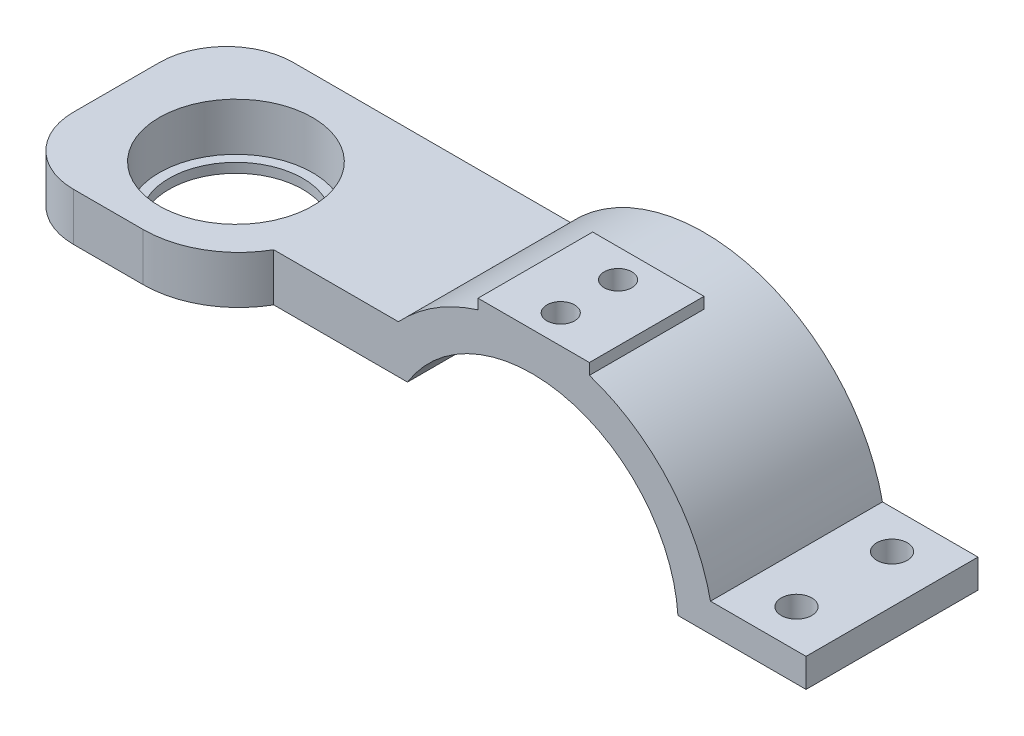
from build123d import *

# Parameters (mm, degrees)
BOSS_EXTRUDE1_DEPTH = 18
SKETCH3_R           = 1.6
CUT_EXTRUDE1_DEPTH  = 56.244999774
SKETCH5_W           = 22.958144304
SKETCH5_H           = 5
BOSS_EXTRUDE2_DEPTH = 5
SKETCH6_R           = 8.025
CUT_EXTRUDE2_DEPTH  = 57.329388422
SKETCH7_R           = 9
SKETCH7_R_2         = 7
BOSS_EXTRUDE3_DEPTH = 1
FILLET1_R           = 7
FILLET2_R           = 10
BOSS_EXTRUDE4_DEPTH = 12
SKETCH9_R           = 1.45
CUT_EXTRUDE3_DEPTH  = 4.15


with BuildPart() as part:
    # Sketch1 → Boss-Extrude1 (new body)
    with BuildSketch(Plane.XY):
        with BuildLine():
            Line((15.267285286, 1), (28.676455767, 1))
            Line((28.676455767, 1), (28.676455767, 4))
            Line((28.676455767, 4), (18.676455767, 4))
            ThreePointArc((18.676455767, 4), (5.072789326, 18.414038353), (-13.99321264, 13))
            Line((-13.99321264, 13), (-50, 13))
            Line((-50, 13), (-50, 8))
            Line((-50, 8), (-13.041855696, 8))
            ThreePointArc((-13.041855696, 8), (3.67261953, 14.852672008), (15.267285286, 1))
        make_face()
    extrude(amount=BOSS_EXTRUDE1_DEPTH)

    # Sketch3 → Cut-Extrude1 (cut, through all)
    with BuildSketch(Plane(origin=(0, 4, 0), x_dir=(1, 0, 0), z_dir=(0, 1, 0))):
        with Locations(Location((23.676455767, -4, 0), (0, 0, 270))):
            Circle(SKETCH3_R)
        with Locations(Location((23.676455767, -14, 0), (0, 0, 270))):
            Circle(SKETCH3_R)
    extrude(amount=-CUT_EXTRUDE1_DEPTH, mode=Mode.SUBTRACT)

    # Sketch5 → Boss-Extrude2 (add)
    with BuildSketch(Plane.XZ.offset(-8)):
        with Locations((-38.520927848, 20.5)):
            Rectangle(SKETCH5_W, SKETCH5_H)
    extrude(amount=-BOSS_EXTRUDE2_DEPTH)

    # Sketch6 → Cut-Extrude2 (cut, through all)
    with BuildSketch(Plane(origin=(0, 13, 0), x_dir=(1, 0, 0), z_dir=(0, 1, 0))):
        with Locations(Location((-37, -12, 0), (0, 0, 180))):
            Circle(SKETCH6_R)
    extrude(amount=-CUT_EXTRUDE2_DEPTH, mode=Mode.SUBTRACT)

    # Sketch7 → Boss-Extrude3 (add)
    with BuildSketch(Plane.XZ.offset(-8)):
        with Locations(Location((-37, 12, 0), (0, 0, 180))):
            Circle(SKETCH7_R)
        with Locations((-37, 12)):
            Circle(SKETCH7_R_2, mode=Mode.SUBTRACT)
    extrude(amount=BOSS_EXTRUDE3_DEPTH)

    # Fillet1
    fillet1_edges = [part.edges().sort_by_distance(p)[0] for p in [
        (-50, 10.5, 23),
        (-50, 10.5, 0),
    ]]
    fillet(fillet1_edges, radius=FILLET1_R)

    # Fillet2
    # the kernel refuses this fillet: 10 mm, written as the material it takes off along each edge
    with BuildSketch(Plane(origin=(-27.041855696, -13.650635095, 23), x_dir=(0, 0, -1), z_dir=(0, 1, 0))) as fillet2_piece_1:
        with BuildLine():
            CenterArc((10, 8.660254038), FILLET2_R, 180, 60)
            Line((0, 8.660254038), (-0.2, 8.660254038))
            Line((-0.2, 8.660254038), (-0.2, 0))
            Line((-0.2, 0), (0, -0.2))
            ThreePointArc((0, -0.2), (2.5, -0.2), (4.9, -0.173205081))
            Line((4.9, -0.173205081), (5, 0))
        make_face()
    extrude(amount=48.301270189, mode=Mode.SUBTRACT)

    # Sketch8 → Boss-Extrude4 (add)
    with BuildSketch(Plane.XY.offset(18)):
        Polygon((6, 18.133118871), (6, 19.3), (-5.66, 19.3), (-5.66, 18.242105142), align=None)
    extrude(amount=-BOSS_EXTRUDE4_DEPTH)

    # Sketch9 → Cut-Extrude3 (cut)
    with BuildSketch(Plane(origin=(0, 19.3, 0), x_dir=(1, 0, 0), z_dir=(0, 1, 0))):
        with Locations(Location((0, -15, 0), (0, 0, 270))):
            Circle(SKETCH9_R)
        with Locations(Location((0, -9, 0), (0, 0, 270))):
            Circle(SKETCH9_R)
    extrude(amount=-CUT_EXTRUDE3_DEPTH, mode=Mode.SUBTRACT)


solid = part.part
